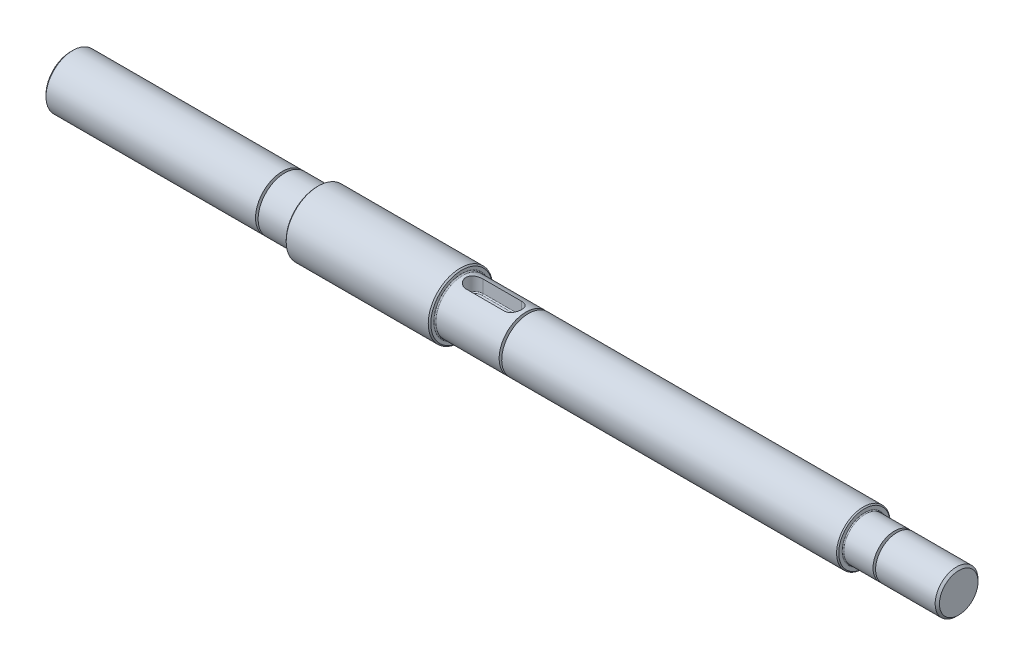
from build123d import *

# Parameters (mm, degrees)
SKETCH3_R           = 10
BOSS_EXTRUDE1_DEPTH = 30
SKETCH4_R           = 12.5
BOSS_EXTRUDE2_DEPTH = 100
SKETCH5_W           = 1.2
SKETCH5_H           = 3
SKETCH6_W           = 1.2
SKETCH6_H           = 2.6
SKETCH7_W           = 1.2
SKETCH7_H           = 3
CUT_EXTRUDE1_START  = 18
CUT_EXTRUDE1_DEPTH  = 18
FILLET1_R           = 0.4
CHAMFER1_SIZE       = 0.5
FILLET2_R           = 0.5
CHAMFER2_SIZE       = 0.6
CHAMFER3_SIZE       = 0.6
FILLET3_R           = 0.5
CUT_EXTRUDE2_DEPTH  = 7
FILLET4_R           = 0.4
FILLET5_R           = 0.4
FILLET6_R           = 0.4
FILLET7_R           = 0.5
CHAMFER4_SIZE       = 1
CHAMFER5_SIZE       = 1


# Read off the part's stored shape, not the designer's step: Revolve-Thin1
with BuildPart() as part:
    # Revolve-Thin1 outline → Revolve-Thin1 (revolve)
    with BuildSketch(Plane.YX):
        Polygon((0, -132.25), (0, -142.25), (12.5, -142.25), (12.5, -127.25), (15, -127.25), (15, -59.75), (12.5, -59.75), (12.5, 128.25), (10, 128.25), (10, 142.25), (0, 142.25), (0, 118.25), (2.5, 118.25), (2.5, -69.75), (5, -69.75), (5, -117.25), (2.5, -117.25), (2.5, -132.25), align=None)
    revolve(axis=Axis((0, 0, 0), (1, 0, 0)))

    # Sketch7 → Cut-Revolve3 (revolve, cut)
    with BuildSketch(Plane.XY, mode=Mode.PRIVATE) as cut_revolve3_sk:
        with Locations((-29.15, 11)):
            Rectangle(SKETCH7_W, SKETCH7_H)
    revolve(cut_revolve3_sk.sketch.rotate(Axis((-29.75, 0, 0), (-1, 0, 0)), 270), axis=Axis((-29.75, 0, 0), (-1, 0, 0)), mode=Mode.SUBTRACT)

    # Sketch8 → Cut-Extrude1 (cut)
    with BuildSketch(Plane(origin=(-53.75, 0, 0), x_dir=(0, 0, -1), z_dir=(1, 0, 0)).offset(CUT_EXTRUDE1_START)):
        with BuildLine():
            Line((-4, 5.5), (4, 5.5))
            Line((4, 5.5), (4, 11.842719282))
            ThreePointArc((4, 11.842719282), (0, 12.5), (-4, 11.842719282))
            Line((-4, 11.842719282), (-4, 5.5))
        make_face()
    extrude(amount=-CUT_EXTRUDE1_DEPTH, mode=Mode.SUBTRACT)

    # Fillet1
    fillet1_edges = [part.edges().sort_by_distance(p)[0] for p in [
        (128.25, -10, 0),
    ]]
    fillet(fillet1_edges, radius=FILLET1_R)

    # Chamfer1
    chamfer1_edges = [part.edges().sort_by_distance(p)[0] for p in [
        (128.25, -12.5, 0),
    ]]
    chamfer(chamfer1_edges, length=CHAMFER1_SIZE)

    # Fillet2
    fillet2_edges = [part.edges().sort_by_distance(p)[0] for p in [
        (-59.75, -12.5, 0),
    ]]
    fillet(fillet2_edges, radius=FILLET2_R)

    # Chamfer2
    chamfer2_edges = [part.edges().sort_by_distance(p)[0] for p in [
        (-59.75, -15, 0),
    ]]
    chamfer(chamfer2_edges, length=CHAMFER2_SIZE)

    # Chamfer3
    chamfer3_edges = [part.edges().sort_by_distance(p)[0] for p in [
        (-127.25, -15, 0),
    ]]
    chamfer(chamfer3_edges, length=CHAMFER3_SIZE)

    # Fillet3
    fillet3_edges = [part.edges().sort_by_distance(p)[0] for p in [
        (-127.25, -12.5, 0),
    ]]
    fillet(fillet3_edges, radius=FILLET3_R)

    # Sketch9 → Cut-Extrude2 (cut)
    with BuildSketch(Plane(origin=(0, 12.5, 0), x_dir=(1, 0, 0), z_dir=(0, 1, 0))):
        with BuildLine():
            Line((-53.75, 4), (-53.75, -4))
            ThreePointArc((-53.75, -4), (-57.75, 0), (-53.75, 4))
        make_face()
        with BuildLine():
            Line((-35.75, 4), (-35.75, -4))
            ThreePointArc((-35.75, -4), (-31.75, 0), (-35.75, 4))
        make_face()
    extrude(amount=-CUT_EXTRUDE2_DEPTH, mode=Mode.SUBTRACT)

    # Fillet5
    fillet5_edges = [part.edges().sort_by_distance(p)[0] for p in [
        (-29.75, 0, -9.5),
        (-28.55, 0, -9.5),
    ]]
    fillet(fillet5_edges, radius=FILLET5_R)



with BuildPart() as body_2:
    # Sketch3 → Boss-Extrude1 (new body)
    with BuildSketch(Plane(origin=(142.25, 0, 0), x_dir=(0, 0, -1), z_dir=(1, 0, 0))):
        with Locations(Location((0, 0, 0), (0, 0, 90))):
            Circle(SKETCH3_R)
    extrude(amount=BOSS_EXTRUDE1_DEPTH)

    # Sketch6 → Cut-Revolve2 (revolve, cut)
    with BuildSketch(Plane.XY, mode=Mode.PRIVATE) as cut_revolve2_sk:
        with Locations((142.85, 8.7)):
            Rectangle(SKETCH6_W, SKETCH6_H)
    revolve(cut_revolve2_sk.sketch.rotate(Axis((172.25, 0, 0), (-1, 0, 0)), 270), axis=Axis((172.25, 0, 0), (-1, 0, 0)), mode=Mode.SUBTRACT)

    # Fillet6
    fillet6_edges = [body_2.edges().sort_by_distance(p)[0] for p in [
        (143.45, 0, -7.4),
    ]]
    fillet(fillet6_edges, radius=FILLET6_R)


with BuildPart() as body_3:
    # Sketch4 → Boss-Extrude2 (new body)
    with BuildSketch(Plane.ZY.offset(142.25)):
        with Locations(Location((0, 0, 0), (0, 0, 270))):
            Circle(SKETCH4_R)
    extrude(amount=BOSS_EXTRUDE2_DEPTH)

    # Sketch5 → Cut-Revolve1 (revolve, cut)
    with BuildSketch(Plane.XY, mode=Mode.PRIVATE) as cut_revolve1_sk:
        with Locations((-142.85, 11)):
            Rectangle(SKETCH5_W, SKETCH5_H)
    revolve(cut_revolve1_sk.sketch.rotate(Axis((-242.25, 0, 0), (1, 0, 0)), 90), axis=Axis((-242.25, 0, 0), (1, 0, 0)), mode=Mode.SUBTRACT)

    # Fillet4
    fillet4_edges = [body_3.edges().sort_by_distance(p)[0] for p in [
        (-143.45, 0, -9.5),
    ]]
    fillet(fillet4_edges, radius=FILLET4_R)

    # Chamfer4
    chamfer4_edges = [body_3.edges().sort_by_distance(p)[0] for p in [
        (-242.25, 12.5, 0),
    ]]
    chamfer(chamfer4_edges, length=CHAMFER4_SIZE)


with BuildPart() as part_1:
    add(part.part)

    add(body_2.part)  # Revolve2 merges body 2
    # Sketch10 → Revolve2 (revolve)
    with BuildSketch(Plane(origin=(0, 0, 0), x_dir=(1, 0, 0), z_dir=(0, 1, 0)), mode=Mode.PRIVATE) as revolve2_sk:
        with BuildLine():
            Line((142.25, 7.8), (142.25, 7.4))
            Line((142.25, 7.4), (142.65, 7.4))
            ThreePointArc((142.65, 7.4), (142.367157288, 7.517157288), (142.25, 7.8))
        make_face()
    revolve(revolve2_sk.sketch.rotate(Axis((172.25, 0, 0), (-1, 0, 0)), 270), axis=Axis((172.25, 0, 0), (-1, 0, 0)))

    # Fillet7
    fillet7_edges = [part_1.edges().sort_by_distance(p)[0] for p in [
        (-44.75, 5.5, 4),
        (-44.75, 5.5, -4),
        (-57.75, 5.5, 0),
        (-31.75, 5.5, 0),
    ]]
    fillet(fillet7_edges, radius=FILLET7_R)

    # Chamfer5
    chamfer5_edges = [part_1.edges().sort_by_distance(p)[0] for p in [
        (172.25, -10, 0),
    ]]
    chamfer(chamfer5_edges, length=CHAMFER5_SIZE)


    add(body_3.part)  # Revolve4 merges body 3
    # Sketch12 → Revolve4 (revolve)
    with BuildSketch(Plane.XY, mode=Mode.PRIVATE) as revolve4_sk:
        with BuildLine():
            Line((-142.25, 9.5), (-142.65, 9.5))
            ThreePointArc((-142.65, 9.5), (-142.367157288, 9.617157288), (-142.25, 9.9))
            Line((-142.25, 9.9), (-142.25, 9.5))
        make_face()
    revolve(revolve4_sk.sketch.rotate(Axis((-241.25, 0, 0), (1, 0, 0)), 90), axis=Axis((-241.25, 0, 0), (1, 0, 0)))


solid = part_1.part
